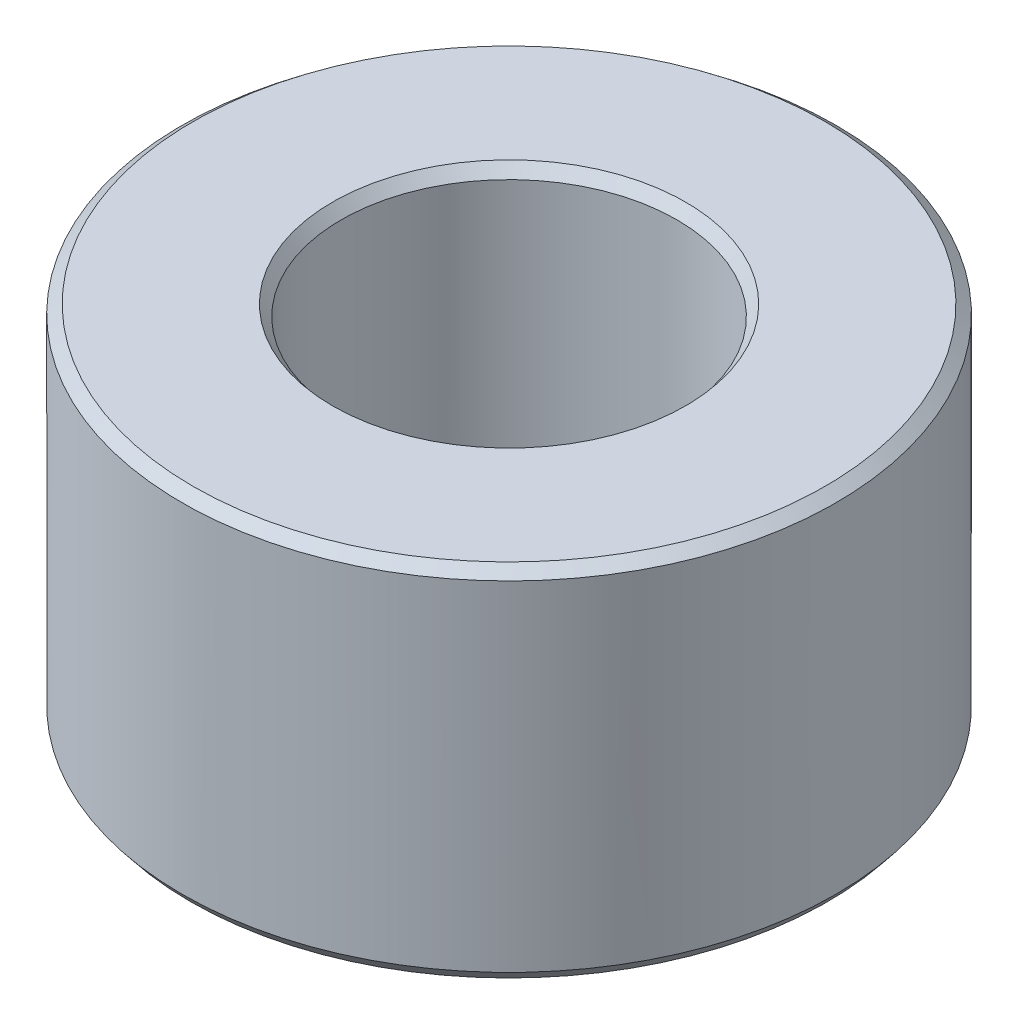
from build123d import *
from OCP.BRepFilletAPI import BRepFilletAPI_MakeChamfer

# Parameters (mm, degrees)
SKETCH1_R           = 42.5
BOSS_EXTRUDE1_DEPTH = 46.625208631
SKETCH2_R           = 21.816783384
CUT_EXTRUDE1_DEPTH  = 77.068456537
CHAMFER1_SIZE       = 1.132480172
CHAMFER1_SIZE2      = 1.427039708


with BuildPart() as part:
    # Sketch1 → Boss-Extrude1 (new body)
    with BuildSketch(Plane(origin=(0, 0, 0), x_dir=(1, 0, 0), z_dir=(0, 1, 0))):
        Circle(SKETCH1_R)
    extrude(amount=BOSS_EXTRUDE1_DEPTH)

    # Sketch2 → Cut-Extrude1 (cut, through all)
    with BuildSketch(Plane(origin=(0, 0, 0), x_dir=(1, 0, 0), z_dir=(0, 1, 0))):
        Circle(SKETCH2_R)
    extrude(amount=CUT_EXTRUDE1_DEPTH, mode=Mode.SUBTRACT)

    # Chamfer1: one chamfer whose edges measure the first distance from different faces: ONE call of the kernel's chamfer builder (chamfer() names one face for all edges)
    chamfer1_edges_1 = [part.edges().sort_by_distance(p)[0] for p in [
        (-21.816783384, 46.625208631, 0),
    ]]
    chamfer1_side_1 = [part.faces().sort_by_distance(p)[0] for p in [
        (-41.297918472, 46.625208631, 0),
    ]]
    chamfer1_edges_2 = [part.edges().sort_by_distance(p)[0] for p in [
        (-21.816783384, 0, 0),
    ]]
    chamfer1_side_2 = [part.faces().sort_by_distance(p)[0] for p in [
        (-21.816783384, 23.312604316, 0),
    ]]
    chamfer1_edges_3 = [part.edges().sort_by_distance(p)[0] for p in [
        (-42.5, 0, 0),
    ]]
    chamfer1_side_3 = [part.faces().sort_by_distance(p)[0] for p in [
        (-41.297918472, 0, 0),
    ]]
    chamfer1_edges_4 = [part.edges().sort_by_distance(p)[0] for p in [
        (-42.5, 46.625208631, 0),
    ]]
    chamfer1_side_4 = [part.faces().sort_by_distance(p)[0] for p in [
        (-42.5, 23.312604316, 0),
    ]]
    chamfer1 = BRepFilletAPI_MakeChamfer(part.part.solid().wrapped)
    for e in chamfer1_edges_1:
        chamfer1.Add(CHAMFER1_SIZE, CHAMFER1_SIZE2, e.wrapped, chamfer1_side_1[0].wrapped)  # the first distance lies on this face
    for e in chamfer1_edges_2:
        chamfer1.Add(CHAMFER1_SIZE, CHAMFER1_SIZE2, e.wrapped, chamfer1_side_2[0].wrapped)  # the first distance lies on this face
    for e in chamfer1_edges_3:
        chamfer1.Add(CHAMFER1_SIZE, CHAMFER1_SIZE2, e.wrapped, chamfer1_side_3[0].wrapped)  # the first distance lies on this face
    for e in chamfer1_edges_4:
        chamfer1.Add(CHAMFER1_SIZE, CHAMFER1_SIZE2, e.wrapped, chamfer1_side_4[0].wrapped)  # the first distance lies on this face
    add(Compound.cast(chamfer1.Shape()), mode=Mode.REPLACE)


solid = part.part
